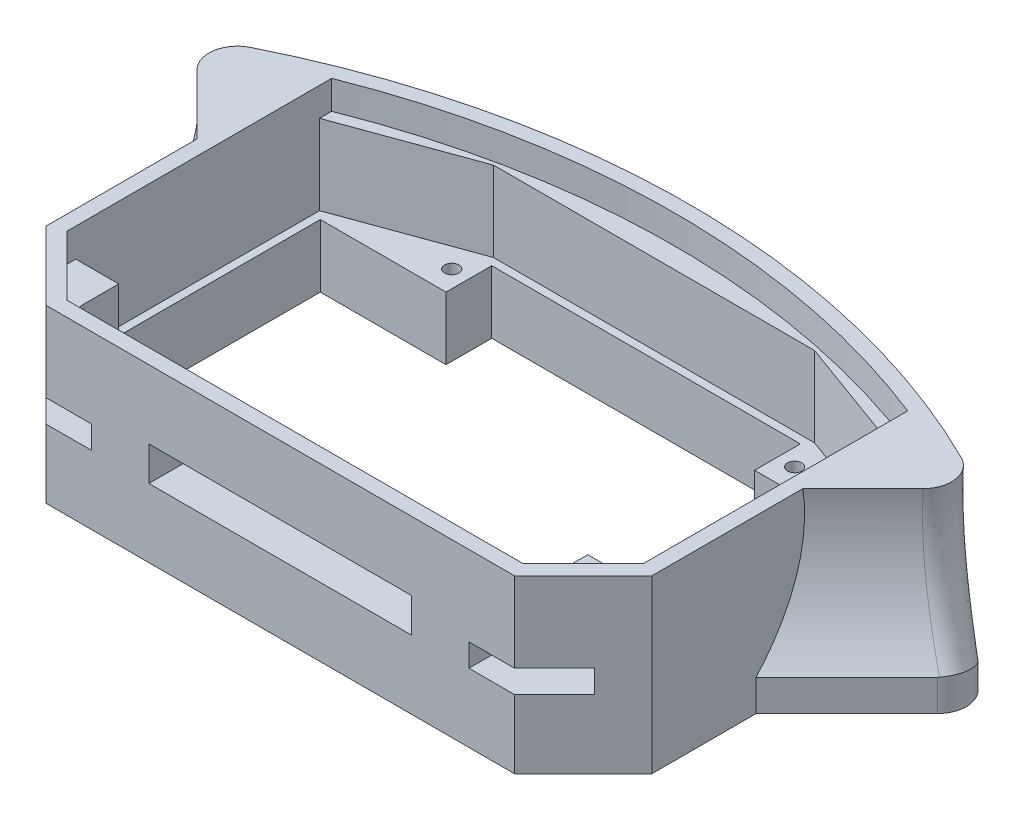
from build123d import *

# Parameters (mm, degrees)
BOSS_EXTRUDE1_DEPTH = 30
CUT_EXTRUDE1_REACH  = 154.306
CUT_EXTRUDE2_DEPTH  = 19
SKETCH5_W           = 82.08
SKETCH5_H           = 54.14
CUT_EXTRUDE4_DEPTH  = 12.4
SKETCH4_R           = 1.25
CUT_EXTRUDE3_DEPTH  = 15
FILLET1_R           = 5
CUT_EXTRUDE5_DEPTH  = 5
BOSS_EXTRUDE2_DEPTH = 30
CUT_EXTRUDE6_REACH  = 160.176
SKETCH8_R           = 38
CUT_EXTRUDE7_REACH  = 179.588
SKETCH9_R           = 38
FILLET2_R           = 5
CUT_EXTRUDE8_REACH  = 106.763
SKETCH10_W          = 15
SKETCH10_H          = 4
SKETCH10_W_2        = 46
SKETCH10_H_2        = 6
CUT_EXTRUDE9_REACH  = 159.473
SKETCH11_R          = 1.25


with BuildPart() as part:
    # Sketch1 → Boss-Extrude1 (new body)
    with BuildSketch(Plane(origin=(0, 0, 0), x_dir=(1, 0, 0), z_dir=(0, 1, 0))):
        with BuildLine():
            Line((53, 80), (53, 129.147822281))
            ThreePointArc((53, 129.147822281), (0, 139.6), (-53, 129.147822281))
            Line((-53, 129.147822281), (-53, 80))
            Line((-53, 80), (-41, 68))
            Line((-41, 68), (41, 68))
            Line((41, 68), (53, 80))
        make_face()
    extrude(amount=BOSS_EXTRUDE1_DEPTH)

    # Sketch2 → Cut-Extrude1 (cut, up to next)
    with BuildSketch(Plane(origin=(0, 30, 0), x_dir=(1, 0, 0), z_dir=(0, 1, 0)), mode=Mode.PRIVATE) as cut_extrude1_sk1:
        Polygon((-49, 84), (49, 84), (49, 124), (27, 124), (27, 132), (-27, 132), (-27, 124), (-49, 124), align=None)
    cut_extrude1_tool1 = extrude(cut_extrude1_sk1.sketch, amount=-CUT_EXTRUDE1_REACH, mode=Mode.PRIVATE) & part.part
    add(cut_extrude1_tool1.solids().sort_by_distance((0, 30, -106.382353))[0], mode=Mode.SUBTRACT)

    # Sketch3 → Cut-Extrude2 (cut)
    with BuildSketch(Plane(origin=(0, 30, 0), x_dir=(1, 0, 0), z_dir=(0, 1, 0))):
        Polygon((-50.4, 125.280170906), (-50.4, 82.6), (50.4, 82.6), (50.4, 125.280170906), (28.070469991, 133.4), (-28.070469991, 133.4), align=None)
    extrude(amount=-CUT_EXTRUDE2_DEPTH, mode=Mode.SUBTRACT)

    # Sketch5 → Cut-Extrude4 (cut)
    with BuildSketch(Plane(origin=(0, 30, 0), x_dir=(1, 0, 0), z_dir=(0, 1, 0))):
        with Locations((-1.84, 98.58)):
            Rectangle(SKETCH5_W, SKETCH5_H)
    extrude(amount=-CUT_EXTRUDE4_DEPTH, mode=Mode.SUBTRACT)

    # Sketch4 → Cut-Extrude3 (cut)
    with BuildSketch(Plane(origin=(0, 17.6, 0), x_dir=(1, 0, 0), z_dir=(0, 1, 0))):
        with Locations(Location((26.18, 74.72, 0), (0, 0, 270))):
            Circle(SKETCH4_R)
        with Locations(Location((-27.53, 74.72, 0), (0, 0, 270))):
            Circle(SKETCH4_R)
    extrude(amount=-CUT_EXTRUDE3_DEPTH, mode=Mode.SUBTRACT)

    # Fillet1
    fillet1_edges = [part.edges().sort_by_distance(p)[0] for p in [
        (-42.88, 23.8, -71.51),
        (39.2, 23.8, -71.51),
    ]]
    fillet(fillet1_edges, radius=FILLET1_R)

    # Sketch6 → Cut-Extrude5 (cut)
    with BuildSketch(Plane(origin=(0, 30, 0), x_dir=(1, 0, 0), z_dir=(0, 1, 0))):
        with BuildLine():
            Line((50.4, 81.076955262), (50.4, 127.392464455))
            ThreePointArc((50.4, 127.392464455), (0, 137), (-50.4, 127.392464455))
            Line((-50.4, 127.392464455), (-50.4, 81.076955262))
            Line((-50.4, 81.076955262), (-39.923044738, 70.6))
            Line((-39.923044738, 70.6), (39.923044738, 70.6))
            Line((39.923044738, 70.6), (50.4, 81.076955262))
        make_face()
    extrude(amount=-CUT_EXTRUDE5_DEPTH, mode=Mode.SUBTRACT)

    # Sketch7 → Boss-Extrude2 (add)
    with BuildSketch(Plane.XZ):
        with BuildLine():
            Line((73.456296502, -118.711130498), (53, -98.254833996))
            Line((53, -98.254833996), (53, -129.147822281))
            ThreePointArc((53, -129.147822281), (63.443123072, -124.350834878), (73.456296502, -118.711130498))
        make_face()
    boss_extrude2 = extrude(amount=-BOSS_EXTRUDE2_DEPTH)

    # Cut-Extrude6: up to this plane
    cut_extrude6_end = Plane(origin=(53, 30, -80), z_dir=(-1, 0, 0))
    # Sketch8 → Cut-Extrude6 (cut, up to the surface)
    with BuildSketch(Plane(origin=(96.0837135, 0, -96.0837135), x_dir=(0, -1, 0), z_dir=(-0.7071067811865488, 0, 0.7071067811865464)), mode=Mode.PRIVATE) as cut_extrude6_sk1:
        with Locations((-26, 0)):
            Circle(SKETCH8_R)
    cut_extrude6_tool1 = split(extrude(cut_extrude6_sk1.sketch, amount=CUT_EXTRUDE6_REACH, mode=Mode.PRIVATE), bisect_by=cut_extrude6_end, keep=Keep.BOTH, mode=Mode.PRIVATE)
    add(cut_extrude6_tool1.solids().sort_by_distance((96.083714, 26, -96.083714))[0], mode=Mode.SUBTRACT)

    # Mirror1: Boss-Extrude2 across plane
    add(boss_extrude2.mirror(Plane(origin=(0, 0, 0), x_dir=(0, 0, 1), z_dir=(1, 0, 0))))

    # Cut-Extrude7: up to this plane
    cut_extrude7_end = Plane(origin=(-53, 30, -129.147822281), z_dir=(1, 0, 0))
    # Sketch9 → Cut-Extrude7 (cut, up to the surface)
    with BuildSketch(Plane(origin=(-96.0837135, 0, -96.0837135), x_dir=(0, -1, 0), z_dir=(0.7071067811865488, 0, 0.7071067811865464)), mode=Mode.PRIVATE) as cut_extrude7_sk1:
        with Locations((-26, 0)):
            Circle(SKETCH9_R)
    cut_extrude7_tool1 = split(extrude(cut_extrude7_sk1.sketch, amount=CUT_EXTRUDE7_REACH, mode=Mode.PRIVATE), bisect_by=cut_extrude7_end, keep=Keep.BOTH, mode=Mode.PRIVATE)
    add(cut_extrude7_tool1.solids().sort_by_distance((-96.083714, 26, -96.083714))[0], mode=Mode.SUBTRACT)

    # Fillet2
    fillet2_edges = [part.edges().sort_by_distance(p)[0] for p in [
        (68.992680179, 17.464833723, -121.359672387),
        (73.456296502, 2.753049234, -118.711130498),
        (-73.456296502, 2.753049234, -118.711130498),
        (-68.992679253, 17.464838179, -121.359672914),
    ]]
    fillet(fillet2_edges, radius=FILLET2_R - 0.0001)  # a hair under: the kernel refuses the full size

    # Sketch10 → Cut-Extrude8 (cut, up to next)
    with BuildSketch(Plane.XY.offset(-68), mode=Mode.PRIVATE) as cut_extrude8_sk1:
        with Locations((-40.5, 14)):
            Rectangle(SKETCH10_W, SKETCH10_H)
    cut_extrude8_tool1 = extrude(cut_extrude8_sk1.sketch, amount=-CUT_EXTRUDE8_REACH, mode=Mode.PRIVATE) & part.part
    # Sketch10 → Cut-Extrude8 (cut, up to next)
    with BuildSketch(Plane.XY.offset(-68), mode=Mode.PRIVATE) as cut_extrude8_sk2:
        with Locations((0, 15)):
            Rectangle(SKETCH10_W_2, SKETCH10_H_2)
    cut_extrude8_tool2 = extrude(cut_extrude8_sk2.sketch, amount=-CUT_EXTRUDE8_REACH, mode=Mode.PRIVATE) & part.part
    # Sketch10 → Cut-Extrude8 (cut, up to next)
    with BuildSketch(Plane.XY.offset(-68), mode=Mode.PRIVATE) as cut_extrude8_sk3:
        with Locations((40.5, 14)):
            Rectangle(SKETCH10_W, SKETCH10_H)
    cut_extrude8_tool3 = extrude(cut_extrude8_sk3.sketch, amount=-CUT_EXTRUDE8_REACH, mode=Mode.PRIVATE) & part.part
    add(cut_extrude8_tool1.solids().sort_by_distance((-40.5, 14, -68))[0], mode=Mode.SUBTRACT)
    add(cut_extrude8_tool2.solids().sort_by_distance((0, 15, -68))[0], mode=Mode.SUBTRACT)
    add(cut_extrude8_tool3.solids().sort_by_distance((40.5, 14, -68))[0], mode=Mode.SUBTRACT)

    # Sketch11 → Cut-Extrude9 (cut, up to next)
    with BuildSketch(Plane(origin=(0, 11, 0), x_dir=(1, 0, 0), z_dir=(0, 1, 0)), mode=Mode.PRIVATE) as cut_extrude9_sk1:
        with Locations(Location((-30, 128, 0), (0, 0, 270))):
            Circle(SKETCH11_R)
    cut_extrude9_tool1 = extrude(cut_extrude9_sk1.sketch, amount=-CUT_EXTRUDE9_REACH, mode=Mode.PRIVATE) & part.part
    # Sketch11 → Cut-Extrude9 (cut, up to next)
    with BuildSketch(Plane(origin=(0, 11, 0), x_dir=(1, 0, 0), z_dir=(0, 1, 0)), mode=Mode.PRIVATE) as cut_extrude9_sk2:
        with Locations(Location((30, 128, 0), (0, 0, 270))):
            Circle(SKETCH11_R)
    cut_extrude9_tool2 = extrude(cut_extrude9_sk2.sketch, amount=-CUT_EXTRUDE9_REACH, mode=Mode.PRIVATE) & part.part
    add(cut_extrude9_tool1.solids().sort_by_distance((-30, 11, -128))[0], mode=Mode.SUBTRACT)
    add(cut_extrude9_tool2.solids().sort_by_distance((30, 11, -128))[0], mode=Mode.SUBTRACT)


solid = part.part
